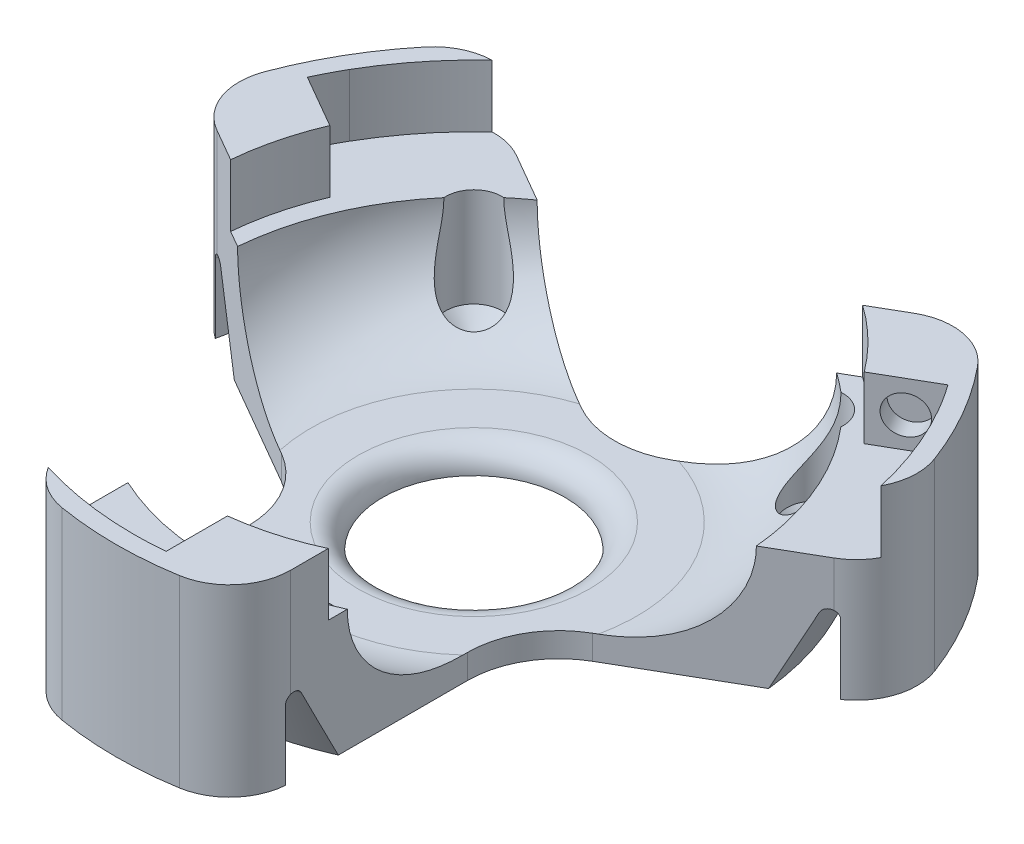
from build123d import *

# Parameters (mm, degrees)
SKETCH2_R                                      = 58.75
SKETCH2_R_2                                    = 42.75
BOSS_EXTRUDE1_DEPTH                            = 16
BOSS_EXTRUDE2_START                            = 4
SKETCH5_R                                      = 58.75
BOSS_EXTRUDE2_DEPTH                            = 4
CUT_EXTRUDE1_DEPTH                             = 86.458323199
CUT_EXTRUDE2_DEPTH                             = 20
CUT_EXTRUDE2_DEPTH_BACK                        = 0.25
SKETCH9_R                                      = 4.6
SKETCH15_R                                     = 15
CUT_EXTRUDE5_DEPTH                             = 12
FILLET1_R                                      = 15
FILLET2_R                                      = 10
FILLET4_R                                      = 4
CSK_FOR_M4_FLAT_HEAD_MACHINE_SCREW3_AT_2_COUNT = 2
CSK_FOR_M4_FLAT_HEAD_MACHINE_SCREW3_AT_2_PITCH = 62.60990337
CSK_FOR_M4_FLAT_HEAD_MACHINE_SCREW3_AT_3_COUNT = 2
CSK_FOR_M4_FLAT_HEAD_MACHINE_SCREW3_AT_3_PITCH = 62.60990337
BOSS_EXTRUDE3_DEPTH                            = 10.2
SKETCH17_R                                     = 3.1
CUT_EXTRUDE6_DEPTH                             = 3.1
CIRPATTERN1_COUNT                              = 3
FILLET5_R                                      = 1.25


with BuildPart() as part:
    # Sketch2 → Boss-Extrude1 (new body)
    with BuildSketch(Plane(origin=(0, 0, 0), x_dir=(1, 0, 0), z_dir=(0, 1, 0))):
        with Locations(Location((0, 0, 0), (0, 0, 270))):
            Circle(SKETCH2_R)
        with Locations(Location((0, 0, 0), (0, 0, 270))):
            Circle(SKETCH2_R_2, mode=Mode.SUBTRACT)
    extrude(amount=BOSS_EXTRUDE1_DEPTH)

    # Sketch4 → Revolve5 (revolve)
    with BuildSketch(Plane.XY):
        with BuildLine():
            Line((42.75, 16), (42.75, 0))
            Line((42.75, 0), (26.75, 0))
            add(Edge.make_bspline(
                [(26.75, 0), (42.75, 0), (42.75, 16)],
                knots=[0, 0, 0, 1.570796327, 1.570796327, 1.570796327], degree=2, weights=[1, 0.707106781, 1]))
        make_face()
    revolve(axis=Axis((0, 16, 0), (0, -1, 0)))

    # Sketch5 → Boss-Extrude2 (add)
    with BuildSketch(Plane.XZ.offset(BOSS_EXTRUDE2_START)):
        with Locations(Location((0, 0, 0), (0, 0, 270))):
            Circle(SKETCH5_R)
    extrude(amount=-BOSS_EXTRUDE2_DEPTH)

    # Sketch6 → Cut-Extrude1 (cut, through all)
    with BuildSketch(Plane.XZ.offset(4)):
        with BuildLine():
            Line((18, 10.392304845), (18, 58.283788484))
            ThreePointArc((18, 58.283788484), (52.827549631, 30.5), (59.475241456, -13.553436974))
            Line((59.475241456, -13.553436974), (18, 10.392304845))
        make_face()
        with BuildLine():
            Line((-18, 10.392304845), (-18, 58.283788484))
            ThreePointArc((-18, 58.283788484), (-52.827549631, 30.5), (-59.475241456, -13.553436974))
            Line((-59.475241456, -13.553436974), (-18, 10.392304845))
        make_face()
        with BuildLine():
            Line((0, -20.784609691), (41.475241456, -44.73035151))
            ThreePointArc((41.475241456, -44.73035151), (0, -61), (-41.475241456, -44.73035151))
            Line((-41.475241456, -44.73035151), (0, -20.784609691))
        make_face()
    extrude(amount=-CUT_EXTRUDE1_DEPTH, mode=Mode.SUBTRACT)

    # Sketch9 → Cut-Extrude2 (cut, two sides: drawn at the far end of the back side and taken through both)
    with BuildSketch(Plane(origin=(0, 0, 0), x_dir=(1, 0, 0), z_dir=(0, 1, 0)).offset(-CUT_EXTRUDE2_DEPTH_BACK)):
        with Locations(Location((0, -28, 0), (0, 0, 270))):
            Circle(SKETCH9_R)
        with Locations(Location((-28, 28, 0), (0, 0, 270))):
            Circle(SKETCH9_R)
        with Locations(Location((28, 28, 0), (0, 0, 270))):
            Circle(SKETCH9_R)
    extrude(amount=CUT_EXTRUDE2_DEPTH + CUT_EXTRUDE2_DEPTH_BACK, mode=Mode.SUBTRACT)

    # Sketch15 → Cut-Extrude5 (cut)
    with BuildSketch(Plane(origin=(0, 0, 0), x_dir=(1, 0, 0), z_dir=(0, 1, 0))):
        with Locations(Location((0, 0, 0), (0, 0, 270))):
            Circle(SKETCH15_R)
    extrude(amount=-CUT_EXTRUDE5_DEPTH, mode=Mode.SUBTRACT)

    # Fillet1
    fillet1_edges = [part.edges().sort_by_distance(p)[0] for p in [
        (-18, -2, 10.392304845),
        (0, -2, -20.784609691),
        (18, -2, 10.392304845),
    ]]
    fillet(fillet1_edges, radius=FILLET1_R)

    # Fillet2
    fillet2_edges = [part.edges().sort_by_distance(p)[0] for p in [
        (-18, 6, 55.924614438),
        (-57.4321368, 6, -12.373849951),
        (-39.4321368, 6, -43.550764487),
        (39.4321368, 6, -43.550764487),
        (57.4321368, 6, -12.373849951),
        (18, 6, 55.924614438),
    ]]
    fillet(fillet2_edges, radius=FILLET2_R)

    # Fillet4
    fillet4_edges = [part.edges().sort_by_distance(p)[0] for p in [
        (0, 0, -15),
    ]]
    fillet(fillet4_edges, radius=FILLET4_R - 0.0001)  # a hair under: the kernel refuses the full size

    # Sketch14 → CSK for M4 Flat Head Machine Screw3 (revolve, cut)
    with BuildSketch(Plane(origin=(0, -0.25, 28), x_dir=(0, 0, 1), z_dir=(1, 0, 0))):
        Polygon((0, 0), (0, 3.75), (2.25, 3.75), (2.25, 2.45), (4.7, 0), align=None)
    csk_for_m4_flat_head_machine_screw3 = revolve(axis=Axis((0, 6.1, 28), (0, -1, 0)), mode=Mode.SUBTRACT)

    # CSK for M4 Flat Head Machine Screw3 at 2: CSK for M4 Flat Head Machine Screw3 ×2
    with Locations(*[Vector(-0.44721359549996426, 0, -0.8944271909999127) * (i * CSK_FOR_M4_FLAT_HEAD_MACHINE_SCREW3_AT_2_PITCH) for i in range(1, CSK_FOR_M4_FLAT_HEAD_MACHINE_SCREW3_AT_2_COUNT)]):
        add(csk_for_m4_flat_head_machine_screw3, mode=Mode.SUBTRACT)

    # CSK for M4 Flat Head Machine Screw3 at 3: CSK for M4 Flat Head Machine Screw3 ×2
    with Locations(*[Vector(0.4472135954999541, 0, -0.8944271909999177) * (i * CSK_FOR_M4_FLAT_HEAD_MACHINE_SCREW3_AT_3_PITCH) for i in range(1, CSK_FOR_M4_FLAT_HEAD_MACHINE_SCREW3_AT_3_COUNT)]):
        add(csk_for_m4_flat_head_machine_screw3, mode=Mode.SUBTRACT)

    # Sketch16 → Boss-Extrude3 (add)
    with BuildSketch(Plane(origin=(0, 16, 0), x_dir=(1, 0, 0), z_dir=(0, 1, 0))):
        with BuildLine():
            Line((-50.704352649, 23.385198905), (-41.99415717, 18.356365201))
            ThreePointArc((-41.99415717, 18.356365201), (-44.149122303, 11.987329266), (-45.283880719, 5.360051032))
            Line((-45.283880719, 5.360051032), (-50.6463909, 8.456097729))
            ThreePointArc((-50.6463909, 8.456097729), (-55.059768773, 13.741693706), (-55.009753136, 20.627398283))
            ThreePointArc((-55.009753136, 20.627398283), (-50.878992472, 29.375), (-45.368727495, 37.32614453))
            ThreePointArc((-45.368727495, 37.32614453), (-42.057063356, 39.947498808), (-37.958596223, 40.967883431))
            ThreePointArc((-37.958596223, 40.967883431), (-43.65293502, 34.837390318), (-48.367518801, 27.925))
            ThreePointArc((-48.367518801, 27.925), (-49.590680363, 25.683278908), (-50.704352649, 23.385198905))
        make_face()
    boss_extrude3 = extrude(amount=BOSS_EXTRUDE3_DEPTH)

    # Sketch17 → Cut-Extrude6 (cut)
    with BuildSketch(Plane(origin=(-2.55, 0, 4.416729559), x_dir=(-0.8660254037844324, 0, -0.500000000000011), z_dir=(0.500000000000011, 0, -0.8660254037844324))):
        with Locations((50.54618952, 21)):
            Circle(SKETCH17_R)
    cut_extrude6 = extrude(amount=-CUT_EXTRUDE6_DEPTH, mode=Mode.SUBTRACT)

    # CirPattern1: Boss-Extrude3, Cut-Extrude6 ×3 about axis
    cirpattern1_axis = Axis((0, 0, 0), (0, 1, 0))
    add([boss_extrude3.rotate(cirpattern1_axis, i * 360 / CIRPATTERN1_COUNT) for i in range(1, CIRPATTERN1_COUNT)])
    add([cut_extrude6.rotate(cirpattern1_axis, i * 360 / CIRPATTERN1_COUNT) for i in range(1, CIRPATTERN1_COUNT)], mode=Mode.SUBTRACT)

    # Sketch18 → Cut-Revolve1 (revolve, cut)
    with BuildSketch(Plane(origin=(0, 0, 0), x_dir=(0, 0, -1), z_dir=(1, 0, 0)), mode=Mode.PRIVATE) as cut_revolve1_sk:
        Polygon((-52.089109994, -4), (-52.089109994, 13), (-44.089109994, -4), align=None)
    revolve(cut_revolve1_sk.sketch.rotate(Axis((0, 16, 0), (0, -1, 0)), 180), axis=Axis((0, 16, 0), (0, -1, 0)), mode=Mode.SUBTRACT)

    # Fillet5
    fillet5_edges = [part.edges().sort_by_distance(p)[0] for p in [
        (-45.110492515, 13, -26.044554997),
        (0, 13, 52.089109994),
        (45.110492515, 13, -26.044554997),
    ]]
    fillet(fillet5_edges, radius=FILLET5_R)


solid = part.part
